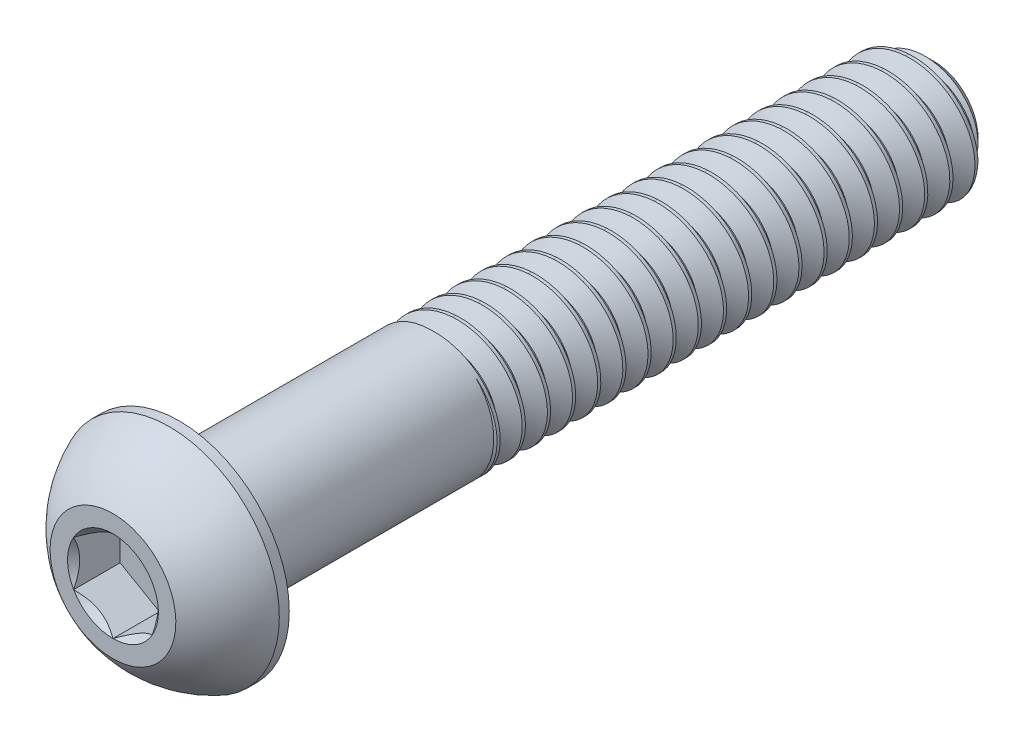
from build123d import *
from build123d.topology import SkipClean

# Parameters (mm, degrees)
SKETCH1_W           = 38.1
SKETCH1_H           = 3.175
CHAMFER1_SIZE       = 0.9525
CUT_SWEEP1_PITCH    = 1.27
CUT_EXTRUDE2_DEPTH  = 2.34696
BOSS_EXTRUDE2_START = -12.7
SKETCH9_R           = 3.175
BOSS_EXTRUDE2_DEPTH = 12.7


with BuildPart() as part:
    # Sketch1 → Revolve1 (revolve)
    with BuildSketch(Plane(origin=(0, 0, 0), x_dir=(0, 0, -1), z_dir=(1, 0, 0))):
        with Locations((22.4028, 1.5875)):
            Rectangle(SKETCH1_W, SKETCH1_H)
    revolve(axis=Axis((0, 0, -41.4528), (0, 0, 1)))

    # Chamfer1
    chamfer1_edges = [part.edges().sort_by_distance(p)[0] for p in [
        (0, -3.175, -41.4528),
    ]]
    chamfer(chamfer1_edges, length=CHAMFER1_SIZE)

    # Cut-Sweep1: the profile of Sketch2 profile screwed along a right-hand helix of 31 turns, 8 arcs to a turn; built about Z, then put on its axis
    cut_sweep1_z = Axis((0, 0, 0), (0, 0, 1))
    cut_sweep1_corners = [(3.1753, 0, 0.000173205), (3.1753, 0, -1.111423205), (2.350110803, 0, -0.635), (2.350110803, 0, -0.47625)]
    with BuildLine(mode=Mode.PRIVATE) as cut_sweep1_profile:
        Line(cut_sweep1_corners[0], cut_sweep1_corners[1])
        Line(cut_sweep1_corners[1], cut_sweep1_corners[2])
        Line(cut_sweep1_corners[2], cut_sweep1_corners[3])
        Line(cut_sweep1_corners[3], cut_sweep1_corners[0])
    cut_sweep1_cap = Face(cut_sweep1_profile.wire())
    cut_sweep1_turn_angles = [0, 22.5, 45, 67.5, 90, 112.5, 135, 157.5, 180, 202.5, 225, 247.5, 270, 292.5, 315, 337.5, 360]
    cut_sweep1_turn_weights = [1, 0.9238795325112867, 1, 0.9238795325112867, 1, 0.9238795325112867, 1, 0.9238795325112867, 1, 0.9238795325112867, 1, 0.9238795325112867, 1, 0.9238795325112867, 1, 0.9238795325112867, 1]
    cut_sweep1_turn_rails = [Edge.make_bspline([Vector(p[0], p[1], 0).rotate(cut_sweep1_z, cut_sweep1_turn_angles[k]) / cut_sweep1_turn_weights[k] + Vector(0, 0, p[2] + CUT_SWEEP1_PITCH * cut_sweep1_turn_angles[k] / 360) for k in range(17)], [0, 0, 0, 1, 1, 2, 2, 3, 3, 4, 4, 5, 5, 6, 6, 7, 7, 8, 8, 8], 2, cut_sweep1_turn_weights) for p in cut_sweep1_corners]
    cut_sweep1_turn_sides = [Face.make_surface_from_curves(cut_sweep1_turn_rails[p[0]], cut_sweep1_turn_rails[p[1]]) for p in [(0, 1), (1, 2), (2, 3), (3, 0)]]
    cut_sweep1 = Plane(origin=(0, 0, -41.4528), x_dir=(0, 1, 0), z_dir=(0, 0, 1)) * Solid(Shell([*[p.moved(Location((0, 0, CUT_SWEEP1_PITCH * i))) for i in range(31) for p in cut_sweep1_turn_sides], cut_sweep1_cap, cut_sweep1_cap.rotate(cut_sweep1_z, 11160).moved(Location((0, 0, CUT_SWEEP1_PITCH * 11160 / 360)))]))
    add(cut_sweep1, mode=Mode.SUBTRACT)

    # Sketch7 → Revolve2 (revolve)
    with BuildSketch(Plane(origin=(0, 0, 0), x_dir=(0, 0, -1), z_dir=(1, 0, 0)), mode=Mode.PRIVATE) as revolve2_sk:
        with BuildLine():
            Line((2.84988, 5.5499), (3.3528, 5.5499))
            Line((3.3528, 5.5499), (3.3528, 0))
            Line((3.3528, 0), (0, 0))
            Line((0, 0), (0, 3.175))
            ThreePointArc((0, 3.175), (1.235921075, 4.58927271), (2.84988, 5.5499))
        make_face()
    revolve(revolve2_sk.sketch.rotate(Axis((0, 0, 0), (0, 0, -1)), 189.052465708), axis=Axis((0, 0, 0), (0, 0, -1)))

    # Sketch5 → Cut-Extrude2 (cut)
    with BuildSketch(Plane.XY):
        Polygon((1.984375, -1.14567944), (1.984375, 1.14567944), (0, 2.291358881), (-1.984375, 1.14567944), (-1.984375, -1.14567944), (0, -2.291358881), align=None)
    extrude(amount=-CUT_EXTRUDE2_DEPTH, mode=Mode.SUBTRACT)

    # Cut-Extrude3 cone 1 section (through the dimple's axis) → Cut-Extrude3 (revolve, cut)
    with BuildSketch(Plane(origin=(0, 0, 0), x_dir=(0, -1, 0), z_dir=(1, 0, 0))):
        Polygon((0, 0), (2.291358881, 0), (0, 2.291358881), align=None)
    revolve(axis=Axis((0, 0, 0), (0, 0, -1)), mode=Mode.SUBTRACT)

    # Sketch9 → Boss-Extrude2 (add)
    with SkipClean():  # the faces are left unmerged after this step: merging them gives an invalid solid
        with BuildSketch(Plane.XY.offset(-3.3528).offset(BOSS_EXTRUDE2_START)):
            with Locations(Location((0, 0, 0), (0, 0, 90))):
                Circle(SKETCH9_R)
        extrude(amount=BOSS_EXTRUDE2_DEPTH)


solid = part.part
